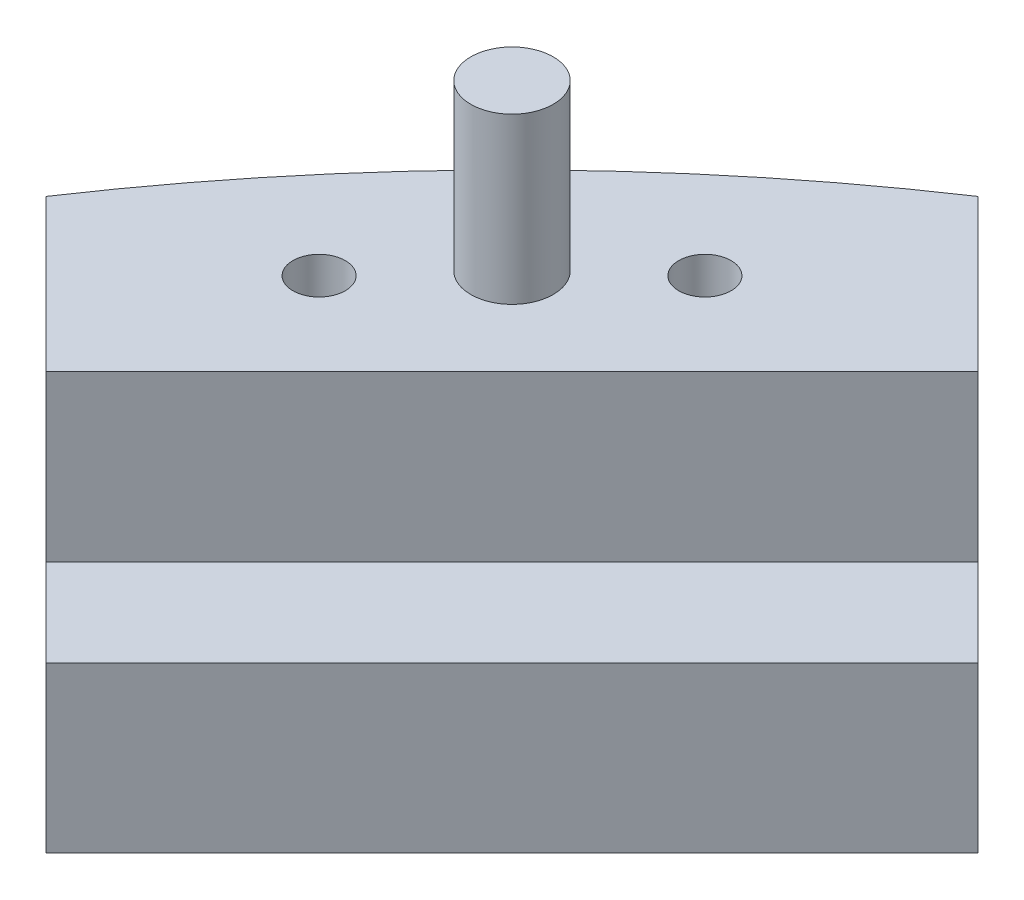
from build123d import *

# Parameters (mm, degrees)
BOSS_EXTRUDE1_DEPTH    = 25.4
CUT_EXTRUDE1_DEPTH     = 136.04018152
F_10_32_TAPPED_HOLE1_D = 4.0386
SKETCH21_R             = 3.175
BOSS_EXTRUDE2_DEPTH    = 12.7
BODY_MOVE_COPY1_ANGLE  = 45


with BuildPart() as part:
    # Sketch1 → Boss-Extrude1 (new, symmetric)
    with BuildSketch(Plane(origin=(0, 0, 0), x_dir=(0, 0, -1), z_dir=(1, 0, 0))):
        Polygon((101.6, 167.392101803), (111.125, 167.392101803), (111.125, 180.092101803), (130.175, 180.092101803), (130.175, 154.692101803), (101.6, 154.692101803), align=None)
    extrude(amount=BOSS_EXTRUDE1_DEPTH, both=True)

    # Sketch23 → Cut-Extrude1 (cut, through all)
    with BuildSketch(Plane(origin=(0, 180.092101803, 0), x_dir=(1, 0, 0), z_dir=(0, 1, 0))):
        with BuildLine():
            Line((6.6e-07, 130.175), (-25.4, 130.175))
            Line((-25.4, 130.175), (-25.4, 127.672904819))
            ThreePointArc((-25.4, 127.672904819), (-12.761469809, 129.547966072), (6.6e-07, 130.175))
        make_face()
        with BuildLine():
            Line((25.4, 130.175), (6.6e-07, 130.175))
            ThreePointArc((6.6e-07, 130.175), (12.761470466, 129.547966007), (25.4, 127.672904819))
            Line((25.4, 127.672904819), (25.4, 130.175))
        make_face()
    extrude(amount=-CUT_EXTRUDE1_DEPTH, mode=Mode.SUBTRACT)

    # #10-32 Tapped Hole1 (through all)
    with Locations(Plane(origin=(0, 180.092101803, 0), x_dir=(1, 0, 0), z_dir=(0, 1, 0))):
        with Locations((-10.515340363, 120.190890325), (10.515340363, 120.190890325)):
            Hole(F_10_32_TAPPED_HOLE1_D / 2)

    # Sketch21 → Boss-Extrude2 (add)
    with BuildSketch(Plane(origin=(0, 180.092101803, 0), x_dir=(1, 0, 0), z_dir=(0, 1, 0))):
        with Locations((0, 120.65)):
            Circle(SKETCH21_R)
    extrude(amount=BOSS_EXTRUDE2_DEPTH)


with BuildPart() as part_1:
    # Body-Move/Copy1: moved
    add(part.part.rotate(Axis((0, 0, 0), (0, 1, 0)), BODY_MOVE_COPY1_ANGLE))


solid = part_1.part
